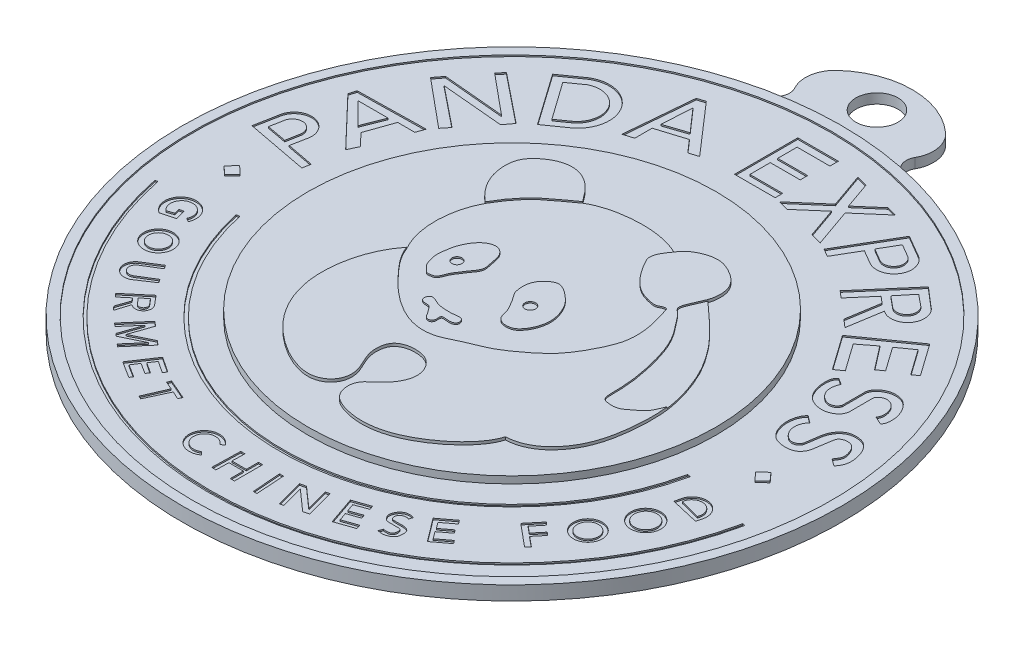
from build123d import *

# Parameters (mm, degrees)
SKETCH2_R           = 59.585697084
BOSS_EXTRUDE1_DEPTH = 2.54
SKETCH3_R           = 57.777230236
CUT_EXTRUDE1_DEPTH  = 0.254
CUT_EXTRUDE2_DEPTH  = 0.254
SKETCH5_R           = 36.881245605
BOSS_EXTRUDE2_DEPTH = 1.27
CUT_EXTRUDE3_DEPTH  = 0.254
BOSS_EXTRUDE3_DEPTH = 0.254
SKETCH8_R           = 2.655932575
SKETCH8_R_2         = 1.808788821
SKETCH8_R_3         = 2.712158749
SKETCH8_R_4         = 2.057032309
SKETCH8_R_5         = 2.610299418
SKETCH8_R_6         = 1.914667872
CUT_EXTRUDE4_DEPTH  = 0.254
BOSS_EXTRUDE4_DEPTH = 0.254
BOSS_EXTRUDE5_DEPTH = 0.254
BOSS_EXTRUDE6_DEPTH = 0.254
SKETCH12_R          = 0.966020788
SKETCH12_R_2        = 0.904370051
CUT_EXTRUDE5_DEPTH  = 0.254
SKETCH13_R          = 3.81
BOSS_EXTRUDE7_DEPTH = 1.778
FILLET1_R           = 2.54


with BuildPart() as part:
    # Sketch2 → Boss-Extrude1 (new body)
    with BuildSketch(Plane(origin=(0, 0, 0), x_dir=(1, 0, 0), z_dir=(0, 1, 0))):
        with Locations((63.5, 63.5)):
            Circle(SKETCH2_R)
    extrude(amount=BOSS_EXTRUDE1_DEPTH)

    # Sketch3 → Cut-Extrude1 (cut)
    with BuildSketch(Plane(origin=(0, 2.54, 0), x_dir=(1, 0, 0), z_dir=(0, 1, 0))):
        with Locations((63.5, 63.5)):
            Circle(SKETCH3_R)
    extrude(amount=-CUT_EXTRUDE1_DEPTH, mode=Mode.SUBTRACT)

    # Sketch4 → Cut-Extrude2 (cut)
    with BuildSketch(Plane(origin=(0, 2.286, 0), x_dir=(1, 0, 0), z_dir=(0, 1, 0))):
        with BuildLine():
            Line((104.528082307, 54.686618315), (103.964031947, 54.789423694))
            ThreePointArc((103.964031947, 54.789423694), (63.528947417, 22.109044671), (23.048191388, 54.732833926))
            Line((23.048191388, 54.732833926), (22.480540809, 54.646571164))
            ThreePointArc((22.480540809, 54.646571164), (63.520482507, 21.535981902), (104.528082307, 54.686618315))
        make_face()
        with BuildLine():
            ThreePointArc((9.729276438, 52.708831095), (63.11681781, 8.658471848), (117.114683543, 51.958520576))
            Line((117.114683543, 51.958520576), (116.650912522, 52.058355236))
            ThreePointArc((116.650912522, 52.058355236), (63.131347385, 9.132777963), (10.19881531, 52.780184355))
            Line((10.19881531, 52.780184355), (9.729276438, 52.708831095))
        make_face()
    extrude(amount=-CUT_EXTRUDE2_DEPTH, mode=Mode.SUBTRACT)

    # Sketch5 → Boss-Extrude2 (add)
    with BuildSketch(Plane(origin=(0, 2.286, 0), x_dir=(1, 0, 0), z_dir=(0, 1, 0))):
        with Locations((63.5, 63.5)):
            Circle(SKETCH5_R)
    extrude(amount=BOSS_EXTRUDE2_DEPTH)

    # Sketch6 → Cut-Extrude3 (cut)
    # profile 1 of 12: a face of its own
    with BuildSketch(Plane(origin=(0, 2.286, 0), x_dir=(1, 0, 0), z_dir=(0, 1, 0))):
        Polygon((47.223923598, 114.900713501), (55.258318466, 105.661159403), (53.61793618, 105.150818248), (51.663947006, 107.397905797), (46.528639427, 105.80025455), (46.528639427, 102.663712087), (44.74387812, 102.11741355), (45.833355256, 114.468092239), align=None)
        Polygon((50.674334152, 108.526203), (46.704141624, 107.198381894), (47.063149195, 112.646849735), align=None, mode=Mode.SUBTRACT)
    # profile 2 of 12: a face of its own
    with BuildSketch(Plane(origin=(0, 2.286, 0), x_dir=(1, 0, 0), z_dir=(0, 1, 0))):
        with BuildLine():
            Line((35.585317901, 96.013362443), (39.079451219, 98.475420795))
            ThreePointArc((39.079451219, 98.475420795), (40.589031323, 106.168198816), (32.970827707, 108.017695889))
            Line((32.970827707, 108.017695889), (29.065658291, 105.266010678))
            Line((29.065658291, 105.266010678), (35.585317901, 96.013362443))
        make_face()
        with BuildLine():
            Line((36.068728972, 98.136701459), (38.139313925, 99.604457882))
            ThreePointArc((38.139313925, 99.604457882), (39.308702772, 105.148499289), (33.873053004, 106.747741925))
            Line((33.873053004, 106.747741925), (31.271791481, 104.903809706))
            Line((31.271791481, 104.903809706), (36.068728972, 98.136701459))
        make_face(mode=Mode.SUBTRACT)
    # profile 3 of 12: a face of its own
    with BuildSketch(Plane(origin=(0, 2.286, 0), x_dir=(1, 0, 0), z_dir=(0, 1, 0))):
        Polygon((33.487921078, 94.241948692), (32.279138139, 92.638461121), (21.081176773, 93.645558288), (28.331365753, 87.82207717), (27.256832741, 86.484291877), (18.562546079, 93.694518324), (19.728810776, 95.241604146), (30.844027373, 94.241948692), (23.66963811, 100.187862143), (24.635048208, 101.3527341), align=None)
    # profile 4 of 12: a face of its own
    with BuildSketch(Plane(origin=(0, 2.286, 0), x_dir=(1, 0, 0), z_dir=(0, 1, 0))):
        Polygon((23.041824824, 76.538554131), (20.891266346, 78.791520156), (22.618116119, 83.700987558), (25.719957547, 83.700987558), (26.254708203, 85.221294046), (13.98771745, 84.999874449), (13.621753934, 83.700987558), (22.194407414, 74.720112483), align=None)
        Polygon((19.546596644, 79.604184769), (21.081176773, 83.51281702), (15.637964392, 83.51281702), align=None, mode=Mode.SUBTRACT)
    # profile 5 of 12: a face of its own
    with BuildSketch(Plane(origin=(0, 2.286, 0), x_dir=(1, 0, 0), z_dir=(0, 1, 0))):
        with BuildLine():
            Line((9.956542906, 70.018432802), (21.081176773, 67.899454922))
            Line((21.081176773, 67.899454922), (21.355778668, 69.341114868))
            Line((21.355778668, 69.341114868), (16.429230263, 70.279505041))
            Line((16.429230263, 70.279505041), (16.917968184, 72.84537913))
            ThreePointArc((16.917968184, 72.84537913), (14.466664642, 76.836303722), (10.719882722, 74.025966837))
            Line((10.719882722, 74.025966837), (9.956542906, 70.018432802))
        make_face()
        with BuildLine():
            Line((15.202826543, 70.692276539), (15.637964392, 73.061935981))
            ThreePointArc((15.637964392, 73.061935981), (14.214360352, 75.220568933), (12.055727401, 73.796964892))
            Line((12.055727401, 73.796964892), (11.597723511, 71.35427748))
            Line((11.597723511, 71.35427748), (15.202826543, 70.692276539))
        make_face(mode=Mode.SUBTRACT)
    # profile 6 of 12: a face of its own
    with BuildSketch(Plane(origin=(0, 2.286, 0), x_dir=(1, 0, 0), z_dir=(0, 1, 0))):
        with BuildLine():
            Line((114.579359821, 70.279505041), (115.869449966, 69.341114868))
            add(Edge.make_bspline(
                [(109.953739943, 73.061935981), (110.115484725, 73.797788887), (110.608815898, 74.933672528), (112.009891772, 75.941219274), (113.424536413, 76.057187771), (114.975470356, 75.749422624), (116.200336165, 74.291721662), (116.730846161, 72.518401452), (116.756840913, 70.668829734), (116.166111845, 69.750654649), (115.869449966, 69.341114868)],
                knots=[0, 0, 0, 0, 0.168852211, 0.263752433, 0.368339543, 0.476800852, 0.602253334, 0.767098206, 0.885618134, 1, 1, 1, 1], degree=3))
            Line((109.953739943, 73.061935981), (109.533010376, 70.279505041))
            add(Edge.make_bspline(
                [(106.95768082, 73.900711422), (106.266914881, 73.28595846), (105.849493781, 71.681457858), (106.796776067, 69.954476786), (108.277211947, 69.006660413), (109.389659757, 69.705933464), (109.533010376, 70.279505041)],
                knots=[0, 0, 0, 0, 0.369280085, 0.573775629, 0.772985613, 1, 1, 1, 1], degree=3))
            Line((106.95768082, 73.900711422), (105.629078645, 74.896779296))
            add(Edge.make_bspline(
                [(105.629078645, 74.896779296), (104.992062301, 74.252577335), (104.494075204, 72.693219078), (104.777271426, 70.36807613), (105.980590203, 68.231236666), (108.239177716, 67.78582134), (110.367502332, 68.082835149), (111.14925186, 69.317477008), (111.268246585, 70.018432802)],
                knots=[0, 0, 0, 0, 0.203455914, 0.348109988, 0.53108444, 0.712474972, 0.834522244, 1, 1, 1, 1], degree=3))
            Line((111.268246585, 70.018432802), (111.703533873, 72.84537913))
            add(Edge.make_bspline(
                [(111.703533873, 72.84537913), (111.770557572, 73.280660389), (111.836111465, 74.032709384), (113.164615293, 74.556945917), (114.536224446, 74.16168275), (115.136163877, 72.867503491), (115.483912957, 71.439595483), (114.801439269, 70.655005655), (114.579359821, 70.279505041)],
                knots=[0, 0, 0, 0, 0.141405096, 0.29765645, 0.468069543, 0.645248048, 0.821101404, 1, 1, 1, 1], degree=3))
        make_face()
    # profile 7 of 12: a face of its own
    with BuildSketch(Plane(origin=(0, 2.286, 0), x_dir=(1, 0, 0), z_dir=(0, 1, 0))):
        with BuildLine():
            Line((102.565688763, 83.51281702), (103.717017386, 82.766092415))
            add(Edge.make_bspline(
                [(103.717017386, 82.766092415), (103.41544978, 82.103795071), (103.111219717, 80.639823451), (104.264297311, 79.044745652), (105.925827854, 78.342515967), (106.92694698, 79.071193425), (107.092687022, 79.604184769)],
                knots=[0, 0, 0, 0, 0.312221958, 0.564891153, 0.770968074, 1, 1, 1, 1], degree=3))
            Line((107.092687022, 79.604184769), (107.092687022, 83.51281702))
            add(Edge.make_bspline(
                [(107.092687022, 83.51281702), (107.029382658, 84.314190987), (107.828124057, 85.367553648), (109.339813503, 86.096927652), (110.725344012, 86.186096908), (112.058899453, 85.741793882), (113.15047506, 84.588218517), (113.824574669, 83.17971018), (114.025984276, 81.550319205), (113.856822191, 80.563274507), (113.51629138, 80.111439594)],
                knots=[0, 0, 0, 0, 0.181099033, 0.287095892, 0.395437788, 0.505121909, 0.611110631, 0.766301317, 0.87034871, 1, 1, 1, 1], degree=3))
            Line((113.51629138, 80.111439594), (112.008710765, 80.799682918))
            add(Edge.make_bspline(
                [(108.764135095, 83.51281702), (108.90077923, 84.147981926), (109.944044652, 84.747300363), (111.153396485, 84.352059638), (111.906046558, 83.723971017), (112.431448124, 82.460944852), (112.447077871, 81.401120944), (112.008710765, 80.799682918)],
                knots=[0, 0, 0, 0, 0.281036547, 0.409573119, 0.548465253, 0.700422911, 1, 1, 1, 1], degree=3))
            Line((108.764135095, 83.51281702), (108.764135095, 79.324875795))
            add(Edge.make_bspline(
                [(102.565688763, 83.51281702), (102.037362657, 83.091857896), (101.803641679, 81.833370295), (102.015695904, 80.23152392), (102.520241489, 78.880073097), (103.415923129, 77.740505156), (104.725529239, 77.173607954), (106.112887987, 76.978620114), (107.774168344, 77.420506148), (108.752660923, 78.397588907), (108.764135095, 79.324875795)],
                knots=[0, 0, 0, 0, 0.149567724, 0.279625345, 0.37789289, 0.484013701, 0.608763579, 0.70101862, 0.807898973, 1, 1, 1, 1], degree=3))
        make_face()
    # profile 8 of 12: a face of its own
    with BuildSketch(Plane(origin=(0, 2.286, 0), x_dir=(1, 0, 0), z_dir=(0, 1, 0))):
        Polygon((108.503394568, 90.573889154), (105.263756197, 95.149301732), (102.565688763, 93.238924768), (105.629078645, 88.912431812), (104.462038119, 88.086104305), (101.217914687, 92.28462818), (98.501063263, 90.185366242), (101.975616608, 85.278178077), (100.610382668, 84.311518966), (96.17628751, 90.573889154), (105.416638576, 97.11655506), (109.533010376, 91.302912564), align=None)
    # profile 9 of 12: a face of its own
    with BuildSketch(Plane(origin=(0, 2.286, 0), x_dir=(1, 0, 0), z_dir=(0, 1, 0))):
        with BuildLine():
            Line((93.757475548, 93.238924768), (95.184420159, 92.013105333))
            Line((95.184420159, 92.013105333), (96.17628751, 98.136701506))
            ThreePointArc((96.17628751, 98.136701506), (100.393206968, 98.843359359), (99.686549115, 103.060278818))
            Line((99.686549115, 103.060278818), (96.349835959, 105.926688492))
            Line((96.349835959, 105.926688492), (88.977711692, 97.344989846))
            Line((88.977711692, 97.344989846), (90.197214322, 96.297373832))
            Line((90.197214322, 96.297373832), (93.539345579, 100.187862143))
            Line((93.539345579, 100.187862143), (94.718898765, 99.174564773))
            Line((94.718898765, 99.174564773), (93.757475548, 93.238924768))
        make_face()
        with BuildLine():
            Line((98.800840503, 102.11741355), (96.627500219, 103.900407703))
            Line((96.627500219, 103.900407703), (94.351269578, 101.125847989))
            Line((94.351269578, 101.125847989), (96.524609861, 99.342853836))
            ThreePointArc((96.524609861, 99.342853836), (98.844617474, 99.760516987), (98.800840503, 102.11741355))
        make_face(mode=Mode.SUBTRACT)
    # profile 10 of 12: a face of its own
    with BuildSketch(Plane(origin=(0, 2.286, 0), x_dir=(1, 0, 0), z_dir=(0, 1, 0))):
        with BuildLine():
            Line((84.901081075, 105.80025455), (87.536486503, 104.262153162))
            ThreePointArc((87.536486503, 104.262153162), (91.827501161, 105.6812704), (90.408383923, 109.972285058))
            Line((90.408383923, 109.972285058), (86.702327646, 112.135250287))
            Line((86.702327646, 112.135250287), (81.021473075, 102.40159093))
            Line((81.021473075, 102.40159093), (82.435774567, 101.576162301))
            Line((82.435774567, 101.576162301), (84.901081075, 105.80025455))
        make_face()
        with BuildLine():
            Line((87.866350035, 105.671775268), (85.570235252, 107.011856494))
            Line((85.570235252, 107.011856494), (87.413512159, 110.170154121))
            Line((87.413512159, 110.170154121), (89.566381699, 108.913675101))
            ThreePointArc((89.566381699, 108.913675101), (90.337315784, 106.442709353), (87.866350035, 105.671775268))
        make_face(mode=Mode.SUBTRACT)
    # profile 11 of 12: a face of its own
    with BuildSketch(Plane(origin=(0, 2.286, 0), x_dir=(1, 0, 0), z_dir=(0, 1, 0))):
        Polygon((71.454619721, 105.304600271), (69.583908526, 105.80025455), (74.988741663, 110.47678698), (72.797593094, 116.728864231), (74.784234464, 116.202988574), (76.477419902, 111.371766125), (80.291180124, 114.67162255), (82.117553351, 114.188170814), (77.245105789, 109.972285058), (79.68132957, 103.020926535), (77.648962798, 103.558905975), (75.738194786, 109.010964037), align=None)
    # profile 12 of 12: a face of its own
    with BuildSketch(Plane(origin=(0, 2.286, 0), x_dir=(1, 0, 0), z_dir=(0, 1, 0))):
        Polygon((68.006281556, 111.090308579), (68.006281556, 112.434213035), (62.601448418, 112.434213035), (62.601448418, 115.940050746), (68.532157212, 115.940050746), (68.532157212, 117.459247087), (61.199113334, 117.459247087), (61.199113334, 106.036059213), (68.532157212, 106.036059213), (68.532157212, 107.397905797), (62.601448418, 107.397905797), (62.601448418, 111.090308579), align=None)
    extrude(amount=-CUT_EXTRUDE3_DEPTH, mode=Mode.SUBTRACT)

    # Sketch7 → Boss-Extrude3 (add)
    with BuildSketch(Plane(origin=(0, 2.286, 0), x_dir=(1, 0, 0), z_dir=(0, 1, 0))):
        Polygon((109.953739943, 61.094659075), (111.268246585, 59.627570713), (112.725302644, 60.933088442), (111.410796001, 62.400176804), align=None)
        Polygon((13.98771745, 60.93629022), (15.402028323, 59.630772491), (16.753308247, 61.094659075), (15.338997374, 62.400176804), align=None)
    extrude(amount=BOSS_EXTRUDE3_DEPTH)

    # Sketch8 → Cut-Extrude4 (cut)
    # profile 1 of 18: a face of its own
    with BuildSketch(Plane(origin=(0, 2.286, 0), x_dir=(1, 0, 0), z_dir=(0, 1, 0))):
        with Locations((19.546596644, 43.51786013)):
            Circle(SKETCH8_R)
        with Locations((19.546596644, 43.51786013)):
            Circle(SKETCH8_R_2, mode=Mode.SUBTRACT)
    # profile 2 of 18: a face of its own
    with BuildSketch(Plane(origin=(0, 2.286, 0), x_dir=(1, 0, 0), z_dir=(0, 1, 0))):
        with Locations((107.375107263, 43.801528642)):
            Circle(SKETCH8_R_3)
        with Locations((107.375107263, 43.801528642)):
            Circle(SKETCH8_R_4, mode=Mode.SUBTRACT)
    # profile 3 of 18: a face of its own
    with BuildSketch(Plane(origin=(0, 2.286, 0), x_dir=(1, 0, 0), z_dir=(0, 1, 0))):
        with Locations((103.717017386, 36.995922458)):
            Circle(SKETCH8_R_5)
        with Locations((103.717017386, 36.995922458)):
            Circle(SKETCH8_R_6, mode=Mode.SUBTRACT)
    # profile 4 of 18: a face of its own
    with BuildSketch(Plane(origin=(0, 2.286, 0), x_dir=(1, 0, 0), z_dir=(0, 1, 0))):
        with BuildLine():
            Line((25.719982847, 37.640310121), (26.117101148, 36.995881248))
            Line((26.117101148, 36.995881248), (23.167015751, 35.02915765))
            ThreePointArc((23.167015751, 35.02915765), (20.395773361, 35.714561063), (21.081176773, 38.485803453))
            Line((21.081176773, 38.485803453), (24.016733043, 40.346486761))
            Line((24.016733043, 40.346486761), (24.423089168, 39.683484663))
            Line((24.423089168, 39.683484663), (21.493381664, 37.887857483))
            ThreePointArc((21.493381664, 37.887857483), (21.0934627, 36.217080508), (22.764721732, 35.819180867))
            Line((22.764721732, 35.819180867), (25.719982847, 37.640310121))
        make_face()
    # profile 5 of 18: a face of its own
    with BuildSketch(Plane(origin=(0, 2.286, 0), x_dir=(1, 0, 0), z_dir=(0, 1, 0))):
        with BuildLine():
            Line((15.202826543, 47.987929953), (17.706599019, 48.646844491))
            Line((17.706599019, 48.646844491), (17.221070969, 50.491775358))
            Line((17.221070969, 50.491775358), (16.454712781, 50.290093873))
            Line((16.454712781, 50.290093873), (16.701299032, 49.353104579))
            Line((16.701299032, 49.353104579), (15.500613341, 48.93963374))
            ThreePointArc((15.500613341, 48.93963374), (16.346689195, 52.472360105), (18.562546079, 49.593822597))
            Line((18.562546079, 49.593822597), (19.227968453, 49.228693933))
            ThreePointArc((19.227968453, 49.228693933), (15.826106227, 53.115288783), (15.202826543, 47.987929953))
        make_face()
    # profile 6 of 18: a face of its own
    with BuildSketch(Plane(origin=(0, 2.286, 0), x_dir=(1, 0, 0), z_dir=(0, 1, 0))):
        with BuildLine():
            Line((112.008710765, 48.170665953), (112.187372693, 48.93963374))
            ThreePointArc((112.187372693, 48.93963374), (110.403634915, 52.387328371), (107.137149619, 50.290093873))
            Line((107.137149619, 50.290093873), (106.919449585, 49.353104579))
            Line((106.919449585, 49.353104579), (112.008710765, 48.170665953))
        make_face()
        with BuildLine():
            Line((107.73410791, 50.04519156), (111.410796001, 49.100182783))
            ThreePointArc((111.410796001, 49.100182783), (110.121418782, 51.70851897), (107.73410791, 50.04519156))
        make_face(mode=Mode.SUBTRACT)
    # profile 7 of 18: a face of its own
    with BuildSketch(Plane(origin=(0, 2.286, 0), x_dir=(1, 0, 0), z_dir=(0, 1, 0))):
        Polygon((96.524609861, 32.049571977), (100.601101698, 28.668916449), (101.154409138, 29.336110502), (99.376992003, 30.810131623), (100.857498878, 32.595369468), (100.292031693, 33.064314296), (98.829295284, 31.30050459), (97.643176834, 32.284158687), (99.165531445, 34.119857737), (98.621187558, 34.571284906), align=None)
    # profile 8 of 18: a face of its own
    with BuildSketch(Plane(origin=(0, 2.286, 0), x_dir=(1, 0, 0), z_dir=(0, 1, 0))):
        Polygon((87.786258367, 24.936292263), (90.934902594, 20.762690353), (93.636094278, 22.800520455), (93.2030109, 23.37458265), (91.017225175, 21.725584553), (90.064572247, 22.988348395), (92.070513523, 24.501668438), (91.620669399, 25.097947395), (89.685123142, 23.637734686), (88.876870209, 24.709092941), (91.005676246, 26.315104484), (90.500865383, 26.984243145), align=None)
    # profile 9 of 18: a face of its own
    with BuildSketch(Plane(origin=(0, 2.286, 0), x_dir=(1, 0, 0), z_dir=(0, 1, 0))):
        with BuildLine():
            Line((85.013154039, 18.71862331), (84.785974612, 18.004769323))
            add(Edge.make_bspline(
                [(86.087658661, 21.041179997), (86.306356937, 21.041179997), (86.809479128, 21.01757272), (87.576936474, 20.549971385), (87.570330544, 19.585442403), (87.425899119, 18.615601135), (86.345599708, 17.876078268), (85.404438631, 17.826422259), (84.785974612, 18.004769323)],
                knots=[0, 0, 0, 0, 0.123616141, 0.223800876, 0.413052222, 0.540296666, 0.695434584, 1, 1, 1, 1], degree=3))
            Line((86.087658661, 21.041179997), (84.660777764, 21.041179997))
            add(Edge.make_bspline(
                [(85.679547024, 22.565528271), (85.442750415, 22.728195327), (84.966797172, 22.684427935), (84.315003316, 22.435961921), (83.915466577, 21.69630309), (84.145993676, 21.014438509), (84.660777764, 21.041179997)],
                knots=[0, 0, 0, 0, 0.255470346, 0.441262349, 0.642293286, 1, 1, 1, 1], degree=3))
            Line((85.679547024, 22.565528271), (85.937017041, 23.243349585))
            add(Edge.make_bspline(
                [(85.937017041, 23.243349585), (85.498634783, 23.3967628), (84.748679597, 23.476462199), (83.887629346, 23.007344596), (83.463766119, 22.455219408), (83.247711143, 21.867944091), (83.211592404, 21.298425198), (83.505773955, 20.788908597), (83.971653608, 20.289470564), (84.406140144, 20.291350021), (84.660777764, 20.291350021)],
                knots=[0, 0, 0, 0, 0.242328595, 0.357847674, 0.489153255, 0.589484125, 0.677824279, 0.769676331, 0.886414245, 1, 1, 1, 1], degree=3))
            Line((84.660777764, 20.291350021), (86.239507769, 20.291350021))
            add(Edge.make_bspline(
                [(86.239507769, 20.291350021), (86.540196655, 20.297161382), (86.766886436, 19.824939136), (86.688050058, 19.16570773), (86.07734291, 18.560544833), (85.400463613, 18.677867475), (85.013154039, 18.71862331)],
                knots=[0, 0, 0, 0, 0.236794651, 0.438211487, 0.60522185, 1, 1, 1, 1], degree=3))
        make_face()
    # profile 10 of 18: a face of its own
    with BuildSketch(Plane(origin=(0, 2.286, 0), x_dir=(1, 0, 0), z_dir=(0, 1, 0))):
        Polygon((77.478596737, 20.291350021), (79.212338386, 15.268664998), (82.533309915, 16.415005378), (82.265768695, 17.190077767), (79.63885879, 16.283315131), (79.140528848, 17.726987169), (81.331010457, 18.483102509), (81.097060872, 19.160859242), (78.918009747, 18.376427754), (78.410823111, 19.785327863), (80.701063476, 20.609786105), (80.456198405, 21.319165224), align=None)
    # profile 11 of 18: a face of its own
    with BuildSketch(Plane(origin=(0, 2.286, 0), x_dir=(1, 0, 0), z_dir=(0, 1, 0))):
        Polygon((70.328619058, 18.269406196), (71.654310109, 13.277805219), (72.311571293, 13.452363497), (71.242918633, 17.476142387), (74.988741663, 14.163378022), (75.987791832, 14.428710102), (74.648597048, 19.471156446), (73.923752675, 19.278649132), (74.988741663, 15.268664998), (71.34822696, 18.488295845), align=None)
    # profile 12 of 18: a face of its own
    with BuildSketch(Plane(origin=(0, 2.286, 0), x_dir=(1, 0, 0), z_dir=(0, 1, 0))):
        Polygon((67.349005141, 12.866892876), (68.006281556, 12.866892876), (67.677643348, 18.004769323), (66.963281059, 18.004769323), align=None)
    # profile 13 of 18: a face of its own
    with BuildSketch(Plane(origin=(0, 2.286, 0), x_dir=(1, 0, 0), z_dir=(0, 1, 0))):
        Polygon((60.702937706, 18.004769323), (59.945202857, 18.004769323), (59.821280481, 12.866892876), (60.592125256, 12.866892876), (60.647534454, 15.164182693), (63.254820349, 15.164182693), (63.254820349, 12.802670331), (64.004875305, 12.802670331), (64.004875305, 17.906852555), (63.254820349, 17.906852555), (63.254820349, 15.707726021), (60.647534454, 15.707726021), align=None)
    # profile 14 of 18: a face of its own
    with BuildSketch(Plane(origin=(0, 2.286, 0), x_dir=(1, 0, 0), z_dir=(0, 1, 0))):
        with BuildLine():
            Line((56.431204882, 14.428710102), (56.960172155, 13.899742829))
            ThreePointArc((56.960172155, 13.899742829), (52.613153884, 16.503867013), (57.569634448, 17.558063882))
            Line((57.569634448, 17.558063882), (56.960172155, 17.190077767))
            ThreePointArc((56.960172155, 17.190077767), (53.362422885, 16.447913916), (56.431204882, 14.428710102))
        make_face()
    # profile 15 of 18: a face of its own
    with BuildSketch(Plane(origin=(0, 2.286, 0), x_dir=(1, 0, 0), z_dir=(0, 1, 0))):
        Polygon((42.086829658, 17.444336329), (42.672697183, 17.190077767), (44.535217161, 21.213124542), (45.978115302, 20.545116745), (46.287377893, 21.213124542), (42.672697183, 22.775983899), (42.397133194, 22.141023994), (43.851253291, 21.509955588), align=None)
    # profile 16 of 18: a face of its own
    with BuildSketch(Plane(origin=(0, 2.286, 0), x_dir=(1, 0, 0), z_dir=(0, 1, 0))):
        Polygon((40.910665173, 23.843570272), (40.510380823, 23.243349585), (38.409932936, 24.644128391), (37.576405625, 23.394266049), (39.455624252, 22.141023994), (39.079451219, 21.547254593), (37.139966467, 22.775983899), (36.301569918, 21.452618928), (38.577053575, 20.011022931), (38.235029865, 19.471156446), (35.249157505, 21.358022948), (38.139313925, 25.691771371), align=None)
    # profile 17 of 18: a face of its own
    with BuildSketch(Plane(origin=(0, 2.286, 0), x_dir=(1, 0, 0), z_dir=(0, 1, 0))):
        Polygon((29.024046917, 26.183181449), (28.434791654, 26.691778198), (31.817872308, 30.611382656), (32.635254901, 29.905885132), (31.271791481, 25.961509687), (35.067066888, 27.806944748), (35.813188277, 27.162954043), (32.430107624, 23.243349585), (31.953523191, 23.654698126), (34.574881276, 26.691778198), (30.647383509, 24.782050627), (30.194157422, 25.173238162), (31.558164016, 29.11918496), align=None)
    # profile 18 of 18: a face of its own
    with BuildSketch(Plane(origin=(0, 2.286, 0), x_dir=(1, 0, 0), z_dir=(0, 1, 0))):
        with BuildLine():
            Line((26.334867701, 28.560627163), (27.14232279, 31.147197558))
            ThreePointArc((27.14232279, 31.147197558), (29.047803731, 31.119363365), (29.347167172, 33.001387246))
            Line((29.347167172, 33.001387246), (27.848167739, 34.783869642))
            Line((27.848167739, 34.783869642), (23.896232943, 31.460443823))
            Line((23.896232943, 31.460443823), (24.423089168, 30.833951293))
            Line((24.423089168, 30.833951293), (26.117075848, 32.258529217))
            Line((26.117075848, 32.258529217), (26.552659555, 31.740570189))
            Line((26.552659555, 31.740570189), (25.719957547, 29.291825922))
            Line((25.719957547, 29.291825922), (26.334867701, 28.560627163))
        make_face()
        with BuildLine():
            Line((26.656553812, 32.757643794), (27.516394023, 31.743802351))
            ThreePointArc((27.516394023, 31.743802351), (28.617521829, 31.653298696), (28.708025484, 32.754426502))
            Line((28.708025484, 32.754426502), (27.848185273, 33.768267945))
            Line((27.848185273, 33.768267945), (26.656553812, 32.757643794))
        make_face(mode=Mode.SUBTRACT)
    extrude(amount=-CUT_EXTRUDE4_DEPTH, mode=Mode.SUBTRACT)

    # Sketch9 → Boss-Extrude4 (add)
    with BuildSketch(Plane(origin=(0, 3.556, 0), x_dir=(1, 0, 0), z_dir=(0, 1, 0))):
        with BuildLine():
            add(Edge.make_bspline(
                [(44.74387812, 77.405963074), (43.808164491, 75.635089884), (42.467377502, 70.815206101), (43.265343312, 65.757269856), (44.74387812, 63.186994649)],
                knots=[0, 0, 0, 0, 0.406141059, 1, 1, 1, 1], degree=3))
            add(Edge.make_bspline(
                [(83.356985793, 42.448135091), (82.885117442, 40.891060569), (80.8168225, 37.976816446), (76.704485495, 34.709183998), (71.232418153, 31.946286484), (65.822264312, 31.65316234), (61.833851627, 33.490337588), (61.05673676, 35.669255244), (61.246082653, 37.762027122), (62.930987765, 39.184811596), (64.421770871, 40.533859997), (65.406753528, 42.096821258), (65.850120512, 43.630230769), (65.682108676, 45.620411898), (64.324813241, 47.553467442), (61.913190482, 48.098432059), (59.960275794, 47.936696647), (58.274863087, 46.949325405), (57.803241578, 45.315922948), (57.835337354, 43.654708488), (58.495265345, 41.666655716), (59.593493392, 39.829111237), (59.653929575, 37.816759998), (59.145905326, 36.274227747), (57.837993874, 34.994428829), (55.711750737, 34.37419368), (52.233973593, 35.027634994), (48.44804374, 37.220395229), (44.610013366, 40.747323455), (42.119270353, 44.807029843), (40.894019836, 49.438094629), (40.94143336, 55.80747199), (42.658697512, 60.544102301), (44.74387812, 63.186994649)],
                knots=[0, 0, 0, 0, 0.048848081, 0.105496188, 0.157748328, 0.231948309, 0.263063303, 0.279857914, 0.298883749, 0.322575547, 0.343013164, 0.360148656, 0.377665077, 0.390165457, 0.419877871, 0.440789258, 0.462195767, 0.478362337, 0.49615376, 0.510229845, 0.528474153, 0.558788721, 0.573415189, 0.587879794, 0.606775714, 0.626173853, 0.652525223, 0.711205705, 0.756090427, 0.809237404, 0.852609887, 0.899287668, 1, 1, 1, 1], degree=3))
            add(Edge.make_bspline(
                [(80.167535347, 82.238911611), (81.327308588, 81.152398364), (83.131924979, 79.640753621), (85.415170872, 77.266546383), (87.133660435, 75.541362304), (88.735328813, 73.37523309), (90.214862178, 71.145875028), (91.575290206, 68.246234075), (92.763079544, 64.896284066), (93.575798936, 60.681258432), (93.398264805, 55.132555554), (92.086961329, 47.373619654), (87.14654715, 42.570186638), (83.356985793, 42.448135091)],
                knots=[0, 0, 0, 0, 0.097430595, 0.143853297, 0.201818613, 0.246303523, 0.308659911, 0.365411963, 0.442027196, 0.526070791, 0.626467993, 0.781225865, 1, 1, 1, 1], degree=3))
            add(Edge.make_bspline(
                [(69.734281714, 86.69844101), (70.360189036, 87.767656639), (72.21739216, 89.016343703), (75.19253193, 89.620351908), (77.879711239, 88.536659589), (80.673493408, 86.406018176), (80.613921165, 83.482286292), (80.167535347, 82.238911611)],
                knots=[0, 0, 0, 0, 0.222957162, 0.400362575, 0.530879726, 0.748916259, 1, 1, 1, 1], degree=3))
            add(Edge.make_bspline(
                [(53.514309905, 86.251940549), (54.791800938, 87.017019237), (57.485636956, 87.942992292), (63.065943824, 88.562073286), (67.19672936, 87.998465546), (69.734281714, 86.69844101)],
                knots=[0, 0, 0, 0, 0.265477682, 0.504085177, 1, 1, 1, 1], degree=3))
            add(Edge.make_bspline(
                [(44.74387812, 77.405963074), (43.422656166, 78.486685685), (41.681226956, 80.555530174), (40.733058923, 84.103113678), (40.878015856, 87.144743443), (43.090744667, 89.406747497), (45.609465234, 90.757817504), (48.373082165, 90.797356212), (51.238432659, 89.339789783), (52.633997046, 87.468772018), (53.514309905, 86.251940549)],
                knots=[0, 0, 0, 0, 0.197911414, 0.294767775, 0.419537713, 0.523307172, 0.641071584, 0.74077696, 0.825966733, 1, 1, 1, 1], degree=3))
        make_face()
    extrude(amount=BOSS_EXTRUDE4_DEPTH)

    # Sketch10 → Boss-Extrude5 (add)
    with BuildSketch(Plane(origin=(0, 3.81, 0), x_dir=(1, 0, 0), z_dir=(0, 1, 0))):
        with BuildLine():
            add(Edge.make_bspline(
                [(80.167535347, 82.238911611), (79.881955233, 81.602052784), (79.432863568, 80.425373899), (78.798014801, 79.155180673), (78.708661591, 77.989064493), (79.884358761, 77.23288173), (80.737641084, 75.883399296), (82.425133067, 73.929571789), (83.758917072, 71.538030546), (84.83501505, 68.276372158), (85.686574468, 64.801038797), (86.133545156, 61.352078771), (86.094675707, 58.959711271), (86.170590238, 57.786380532), (86.589310441, 57.126840829), (87.649779133, 56.942887706), (89.182146904, 56.898872515), (90.627630985, 58.149485096), (92.460536048, 59.387508135), (92.917991273, 60.966434424), (93.294339647, 61.766058562)],
                knots=[0, 0, 0, 0, 0.057766813, 0.103672069, 0.117956731, 0.148668786, 0.205071587, 0.25331961, 0.360504475, 0.428907948, 0.536815397, 0.656119094, 0.714716867, 0.734870301, 0.752719928, 0.77398511, 0.81941867, 0.875141297, 0.924623561, 1, 1, 1, 1], degree=3))
            add(Edge.make_bspline(
                [(69.734281714, 86.69844101), (70.360189036, 87.767656639), (72.21739216, 89.016343703), (75.19253193, 89.620351908), (77.879711239, 88.536659589), (80.673493408, 86.406018176), (80.613921165, 83.482286292), (80.167535347, 82.238911611)],
                knots=[0, 0, 0, 0, 0.222957162, 0.400362575, 0.530879726, 0.748916259, 1, 1, 1, 1], degree=3))
            add(Edge.make_bspline(
                [(44.74387812, 63.186994649), (45.467113979, 61.254961844), (47.676149265, 58.726947881), (50.830408268, 55.471178776), (53.917817232, 53.180523084), (57.299034592, 51.649119614), (61.102021077, 51.618575105), (64.542731261, 53.546753448), (68.355060115, 54.845512348), (71.870661201, 57.347938662), (74.853369214, 59.763860765), (76.93588451, 62.872039282), (78.271024912, 65.470702994), (79.292853586, 68.20713537), (79.46564637, 71.068940133), (78.893193993, 74.057401554), (78.25833824, 75.82600176), (77.949025693, 77.147165669), (77.370973217, 77.073738504), (76.949261582, 76.894805557), (76.327987657, 76.533455256), (75.366819064, 76.678257845), (74.263588222, 76.929352573), (72.90388857, 77.453338955), (70.848840027, 79.00683485), (69.349881094, 81.161817778), (68.013567984, 83.542053934), (68.687881727, 85.301914885), (69.400818616, 86.197521815), (69.734281714, 86.69844101)],
                knots=[0, 0, 0, 0, 0.084514406, 0.138542655, 0.188997658, 0.2440984, 0.290772339, 0.341068537, 0.405873514, 0.457940509, 0.519982684, 0.56458379, 0.612626876, 0.641877537, 0.685531119, 0.73100779, 0.764110178, 0.772246733, 0.778109857, 0.784701352, 0.792201311, 0.807113867, 0.822926653, 0.840087916, 0.867255606, 0.928578202, 0.950665232, 0.975318232, 1, 1, 1, 1], degree=3))
            add(Edge.make_bspline(
                [(83.356985793, 42.448135091), (82.885117442, 40.891060569), (80.8168225, 37.976816446), (76.704485495, 34.709183998), (71.232418153, 31.946286484), (65.822264312, 31.65316234), (61.833851627, 33.490337588), (61.05673676, 35.669255244), (61.246082653, 37.762027122), (62.930987765, 39.184811596), (64.421770871, 40.533859997), (65.406753528, 42.096821258), (65.850120512, 43.630230769), (65.682108676, 45.620411898), (64.324813241, 47.553467442), (61.913190482, 48.098432059), (59.960275794, 47.936696647), (58.274863087, 46.949325405), (57.803241578, 45.315922948), (57.835337354, 43.654708488), (58.495265345, 41.666655716), (59.593493392, 39.829111237), (59.653929575, 37.816759998), (59.145905326, 36.274227747), (57.837993874, 34.994428829), (55.711750737, 34.37419368), (52.233973593, 35.027634994), (48.44804374, 37.220395229), (44.610013366, 40.747323455), (42.119270353, 44.807029843), (40.894019836, 49.438094629), (40.94143336, 55.80747199), (42.658697512, 60.544102301), (44.74387812, 63.186994649)],
                knots=[0, 0, 0, 0, 0.048848081, 0.105496188, 0.157748328, 0.231948309, 0.263063303, 0.279857914, 0.298883749, 0.322575547, 0.343013164, 0.360148656, 0.377665077, 0.390165457, 0.419877871, 0.440789258, 0.462195767, 0.478362337, 0.49615376, 0.510229845, 0.528474153, 0.558788721, 0.573415189, 0.587879794, 0.606775714, 0.626173853, 0.652525223, 0.711205705, 0.756090427, 0.809237404, 0.852609887, 0.899287668, 1, 1, 1, 1], degree=3))
            add(Edge.make_bspline(
                [(93.294339647, 61.766058562), (93.330288645, 61.490233821), (93.540727108, 59.585113415), (93.398264805, 55.132555554), (92.086961329, 47.373619654), (87.14654715, 42.570186638), (83.356985793, 42.448135091)],
                knots=[0.509035817, 0.509035817, 0.509035817, 0.509035817, 0.526070791, 0.626467993, 0.781225865, 1, 1, 1, 1], degree=3))
        make_face()
        with BuildLine():
            add(Edge.make_bspline(
                [(44.74387812, 77.405963074), (43.422656166, 78.486685685), (41.681226956, 80.555530174), (40.733058923, 84.103113678), (40.878015856, 87.144743443), (43.090744667, 89.406747497), (45.609465234, 90.757817504), (48.373082165, 90.797356212), (51.238432659, 89.339789783), (52.633997046, 87.468772018), (53.514309905, 86.251940549)],
                knots=[0, 0, 0, 0, 0.197911414, 0.294767775, 0.419537713, 0.523307172, 0.641071584, 0.74077696, 0.825966733, 1, 1, 1, 1], degree=3))
            add(Edge.make_bspline(
                [(44.74387812, 77.405963074), (45.850005566, 79.371636773), (48.376523546, 82.854474249), (52.007687526, 85.062551797), (53.514309905, 86.251940549)],
                knots=[0, 0, 0, 0, 0.540843107, 1, 1, 1, 1], degree=3))
        make_face()
    extrude(amount=BOSS_EXTRUDE5_DEPTH)

    # Sketch11 → Boss-Extrude6 (add)
    with BuildSketch(Plane(origin=(0, 3.81, 0), x_dir=(1, 0, 0), z_dir=(0, 1, 0))):
        with BuildLine():
            add(Edge.make_bspline(
                [(54.479388341, 57.548251174), (54.324011653, 57.391310068), (54.199623636, 57.001821387), (54.30813812, 56.421754656), (54.857874185, 56.098938307), (55.412346021, 56.133426739), (56.063637481, 56.051946126), (56.458833806, 55.415090529), (57.006287725, 54.776961124), (57.380765795, 53.928376214), (58.25170896, 53.786110377), (58.649497151, 54.267365379), (58.695858431, 54.746080024), (58.618662439, 55.134320914), (58.726977419, 55.549940168), (59.377561665, 55.576276461), (60.045661616, 55.432563854), (60.849275681, 55.564534718), (61.263968236, 56.015400195), (61.232215387, 56.492306525), (60.974529448, 57.007184563), (60.252127827, 57.079241991), (59.381251788, 56.897011656), (58.310670827, 56.905525922), (57.224693878, 56.961592703), (56.296771004, 57.206103001), (55.579162183, 57.559181191), (54.91694707, 57.840151445), (54.568198514, 57.637955538), (54.479388341, 57.548251174)],
                knots=[0, 0, 0, 0, 0.036106589, 0.062336841, 0.091907312, 0.131240911, 0.155318515, 0.195472742, 0.245251394, 0.299916132, 0.338293265, 0.366672099, 0.392866061, 0.415348381, 0.434491004, 0.452966774, 0.510738437, 0.555498635, 0.578914086, 0.60486866, 0.629849438, 0.667816077, 0.710997336, 0.781408442, 0.842707124, 0.892099018, 0.937971634, 0.979362204, 1, 1, 1, 1], degree=3))
        make_face()
        with BuildLine():
            add(Edge.make_bspline(
                [(61.930683474, 69.575157448), (61.680377758, 69.173100424), (61.333073292, 68.256891047), (61.392463259, 66.992211813), (61.589716653, 65.717847892), (62.479371382, 64.747801231), (63.086427703, 63.608798494), (63.662258435, 62.679049521), (63.981338829, 61.748785563), (64.130189775, 60.716818491), (65.13404615, 59.939892883), (66.237561992, 59.894203854), (67.296218358, 60.168779338), (68.12165113, 60.991981528), (68.824334269, 62.175640428), (69.301891317, 63.68900173), (69.342439178, 65.318941473), (68.874636805, 66.968189153), (68.071577598, 68.64804806), (66.715220484, 69.92194016), (65.457696557, 70.876487358), (64.118607433, 71.391647192), (62.856900975, 70.678938004), (62.201586516, 70.01029921), (61.930683474, 69.575157448)],
                knots=[0, 0, 0, 0, 0.047973722, 0.095522008, 0.127525434, 0.175725498, 0.223942352, 0.258908318, 0.285730587, 0.323598663, 0.360383407, 0.403074962, 0.431608366, 0.468759024, 0.516913296, 0.570709176, 0.627584541, 0.679153117, 0.74323881, 0.813588199, 0.863942717, 0.905430052, 0.948078584, 1, 1, 1, 1], degree=3))
        make_face()
        with BuildLine():
            add(Edge.make_bspline(
                [(48.906026634, 67.195133403), (48.828475995, 66.861529403), (48.670334302, 65.943609874), (48.517960665, 64.569666475), (48.874974761, 63.226461699), (49.256854849, 62.169536248), (49.968601244, 61.64754112), (50.43561963, 60.934368572), (51.215580946, 61.074983486), (51.96822614, 61.245329394), (52.313423104, 61.933911972), (52.608953893, 62.772140529), (53.104565043, 63.645218495), (53.74655262, 64.662193539), (54.504232249, 65.616563747), (55.298343618, 66.932184822), (54.707001369, 68.560799011), (54.604565896, 70.274591668), (53.375688679, 71.495273823), (51.601468849, 71.422762247), (49.853199272, 69.893456737), (49.140562532, 68.204049831), (48.906026634, 67.195133403)],
                knots=[0, 0, 0, 0, 0.039285191, 0.10705015, 0.155046076, 0.198819305, 0.230300115, 0.255997714, 0.287600378, 0.310213966, 0.342509637, 0.36739618, 0.414092385, 0.456246384, 0.504900639, 0.555859587, 0.621087893, 0.690162674, 0.751379238, 0.795009416, 0.881190048, 1, 1, 1, 1], degree=3))
        make_face()
    extrude(amount=BOSS_EXTRUDE6_DEPTH)

    # Sketch12 → Cut-Extrude5 (cut)
    with BuildSketch(Plane(origin=(0, 4.064, 0), x_dir=(1, 0, 0), z_dir=(0, 1, 0))):
        with Locations((65.111811427, 65.183648352)):
            Circle(SKETCH12_R)
        with Locations((51.414090698, 65.63073439)):
            Circle(SKETCH12_R_2)
    extrude(amount=-CUT_EXTRUDE5_DEPTH, mode=Mode.SUBTRACT)

    # Sketch13 → Boss-Extrude7 (add)
    with BuildSketch(Plane.XZ):
        with BuildLine():
            ThreePointArc((53.711734453, -132.107616235), (63.5, -135.873064465), (73.288265547, -132.107616235))
            ThreePointArc((73.288265547, -132.107616235), (74.731315772, -126.265565296), (69.85, -122.746373704))
            ThreePointArc((69.85, -122.746373704), (63.5, -123.085697084), (57.15, -122.746373704))
            ThreePointArc((57.15, -122.746373704), (52.268684228, -126.265565296), (53.711734453, -132.107616235))
        make_face()
        with Locations((63.5, -129.479380775)):
            Circle(SKETCH13_R, mode=Mode.SUBTRACT)
    extrude(amount=-BOSS_EXTRUDE7_DEPTH)

    # Fillet1
    fillet1_edges = [part.edges().sort_by_distance(p)[0] for p in [
        (69.85, 0.889, -122.746373704),
        (57.15, 0.889, -122.746373704),
    ]]
    fillet(fillet1_edges, radius=FILLET1_R)


solid = part.part
